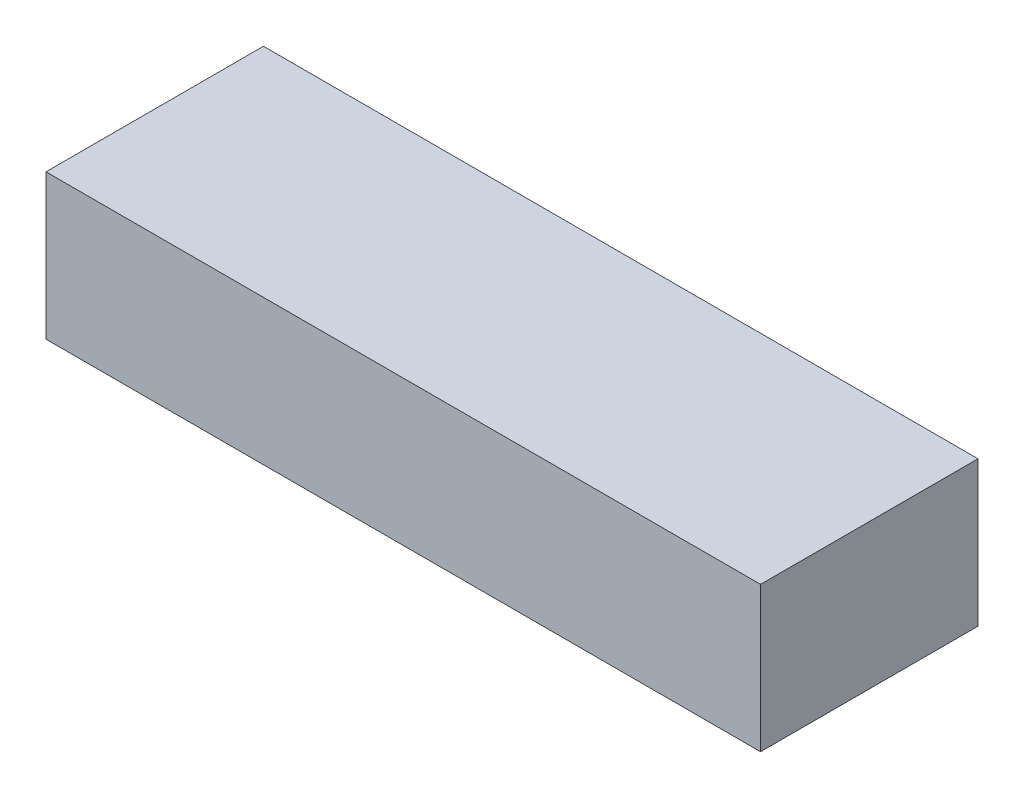
from build123d import *

# Parameters (mm, degrees)
SKETCH1_W           = 138
SKETCH1_H           = 42
BOSS_EXTRUDE1_DEPTH = 28


with BuildPart() as part:
    # Sketch1 → Boss-Extrude1 (new body)
    with BuildSketch(Plane(origin=(0, 0, 0), x_dir=(1, 0, 0), z_dir=(0, 1, 0))):
        Rectangle(SKETCH1_W, SKETCH1_H)
    extrude(amount=BOSS_EXTRUDE1_DEPTH)


solid = part.part
